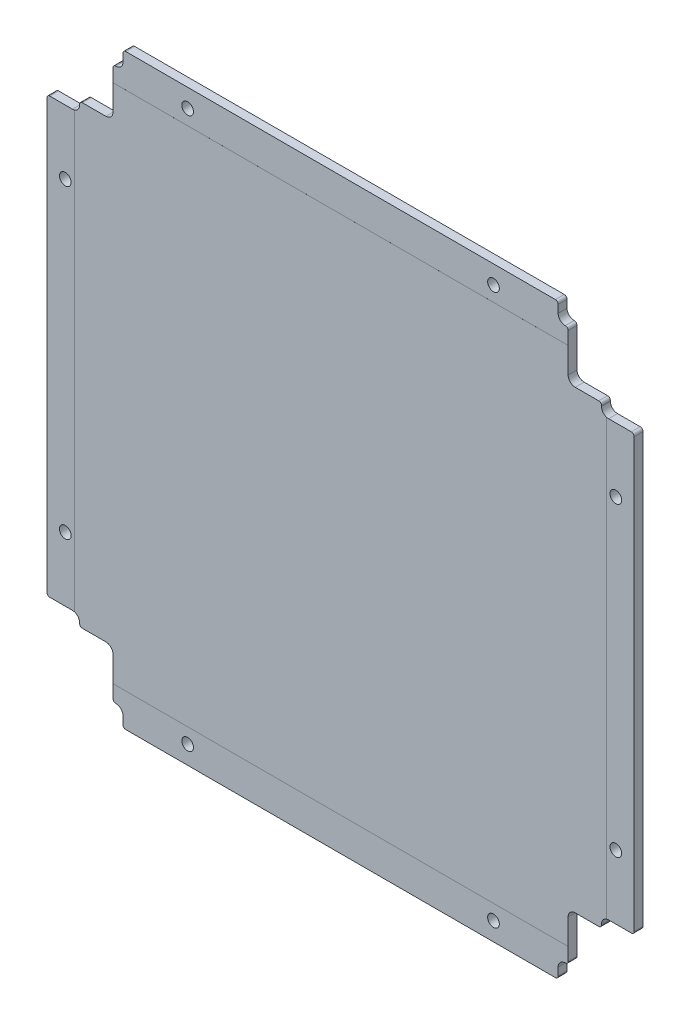
from build123d import *

# Parameters (mm, degrees)
SKETCH1_W                 = 106
SKETCH1_H                 = 106
MAINOUTLINE_DEPTH         = 1.6
SKETCH4_W                 = 11.7
SKETCH4_H                 = 11.7
RAILCUTOUTS_DEPTH         = 75.970394157
SKETCH13_W                = 5.7
SKETCH13_H                = 1.9
SKETCH13_W_2              = 1.8
SKETCH13_H_2              = 3
FILLETCUTOUTS_DEPTH       = 75.970394157
SMOOTHCORNER_DEPTH        = 10
MIRROR2_COPY_1_SKETCH_W   = 11.7
MIRROR2_COPY_1_SKETCH_H   = 11.7
MIRROR2_COPY_1_DEPTH      = 75.970394157
MIRROR2_COPY_2_SKETCH_W   = 5.7
MIRROR2_COPY_2_SKETCH_H   = 1.9
MIRROR2_COPY_2_SKETCH_W_2 = 1.8
MIRROR2_COPY_2_SKETCH_H_2 = 3
MIRROR2_COPY_2_DEPTH      = 75.970394157
MIRROR2_COPY_3_DEPTH      = 10
MIRROR2_COPY_4_SKETCH_W   = 11.7
MIRROR2_COPY_4_SKETCH_H   = 11.7
MIRROR2_COPY_4_DEPTH      = 75.970394157
MIRROR2_COPY_5_SKETCH_W   = 5.7
MIRROR2_COPY_5_SKETCH_H   = 1.9
MIRROR2_COPY_5_SKETCH_W_2 = 1.8
MIRROR2_COPY_5_SKETCH_H_2 = 3
MIRROR2_COPY_5_DEPTH      = 75.970394157
MIRROR2_COPY_6_DEPTH      = 10
FILLET10_R                = 0.5
M2_CLEARANCE_HOLE1_D      = 2.1
SKETCH15_W                = 90
SKETCH15_H                = 6.2
SKETCH15_W_2              = 5.2
SKETCH15_H_2              = 90
CUT_EXTRUDE5_DEPTH        = 0.001
SKETCH16_W                = 90
SKETCH16_H                = 6.2
SKETCH16_W_2              = 5.2
SKETCH16_H_2              = 90
CUT_EXTRUDE6_DEPTH        = 0.001
SKETCH24_OUTSIDE_W        = 137.984
SKETCH24_OUTSIDE_H        = 137.984
SKETCH24_OUTSIDE_W_2      = 105.6
SKETCH24_OUTSIDE_H_2      = 105.6
CUT_EXTRUDE19_DEPTH       = 75.970394157
FILLET7_R                 = 0.5


with BuildPart() as part:
    # Sketch1 → mainOutline (new body)
    with BuildSketch(Plane.XY):
        Rectangle(SKETCH1_W, SKETCH1_H)
    extrude(amount=MAINOUTLINE_DEPTH)

    # Sketch4 → railCutouts (cut, through all)
    with BuildSketch(Plane(origin=(0, 0, 0), x_dir=(-1, 0, 0), z_dir=(0, 0, -1))):
        with Locations((47.15, 47.15)):
            Rectangle(SKETCH4_W, SKETCH4_H)
    railcutouts = extrude(amount=-RAILCUTOUTS_DEPTH, mode=Mode.SUBTRACT)

    # Sketch13 → filletCutouts (cut, symmetric)
    with BuildSketch(Plane(origin=(0, 0, 0), x_dir=(-1, 0, 0), z_dir=(0, 0, -1))):
        with Locations((50.15, 40.35)):
            Rectangle(SKETCH13_W, SKETCH13_H)
        with Locations((40.4, 51.5)):
            Rectangle(SKETCH13_W_2, SKETCH13_H_2)
    filletcutouts = extrude(amount=FILLETCUTOUTS_DEPTH, both=True, mode=Mode.SUBTRACT)

    # Sketch27 → smoothCorner (cut)
    with BuildSketch(Plane.XY.offset(1.6)):
        with BuildLine():
            Line((-40.928025612, 42.198025612), (-40.928025612, 49.628025612))
            Line((-40.928025612, 49.628025612), (-40.398025612, 49.628025612))
            ThreePointArc((-40.398025612, 49.628025612), (-39.5, 50), (-39.128025612, 50.898025612))
            Line((-39.128025612, 50.898025612), (-39.128025612, 53))
            Line((-39.128025612, 53), (-53, 53))
            Line((-53, 53), (-53, 39.028025612))
            Line((-53, 39.028025612), (-48.198025612, 39.028025612))
            ThreePointArc((-48.198025612, 39.028025612), (-47.3, 39.4), (-46.928025612, 40.298025612))
            Line((-46.928025612, 40.298025612), (-46.928025612, 40.928025612))
            Line((-46.928025612, 40.928025612), (-42.198025612, 40.928025612))
            ThreePointArc((-42.198025612, 40.928025612), (-41.3, 41.3), (-40.928025612, 42.198025612))
        make_face()
    smoothcorner = extrude(amount=-SMOOTHCORNER_DEPTH, mode=Mode.SUBTRACT)

    # Mirror1: railCutouts, filletCutouts, smoothCorner across plane
    add(railcutouts.mirror(Plane(origin=(0, 0, 0), x_dir=(0, 0, 1), z_dir=(1, 0, 0))), mode=Mode.SUBTRACT)
    add(filletcutouts.mirror(Plane(origin=(0, 0, 0), x_dir=(0, 0, 1), z_dir=(1, 0, 0))), mode=Mode.SUBTRACT)
    add(smoothcorner.mirror(Plane(origin=(0, 0, 0), x_dir=(0, 0, 1), z_dir=(1, 0, 0))), mode=Mode.SUBTRACT)

    # Mirror2 copy 1 sketch → Mirror2 copy 1 (cut, through all)
    with BuildSketch(Plane(origin=(0, 0, 0), x_dir=(1, 0, 0), z_dir=(0, 0, -1))):
        with Locations((47.15, 47.15)):
            Rectangle(MIRROR2_COPY_1_SKETCH_W, MIRROR2_COPY_1_SKETCH_H)
    extrude(amount=-MIRROR2_COPY_1_DEPTH, mode=Mode.SUBTRACT)

    # Mirror2 copy 2 sketch → Mirror2 copy 2 (cut, symmetric)
    with BuildSketch(Plane(origin=(0, 0, 0), x_dir=(1, 0, 0), z_dir=(0, 0, -1))):
        with Locations((50.15, 40.35)):
            Rectangle(MIRROR2_COPY_2_SKETCH_W, MIRROR2_COPY_2_SKETCH_H)
        with Locations((40.4, 51.5)):
            Rectangle(MIRROR2_COPY_2_SKETCH_W_2, MIRROR2_COPY_2_SKETCH_H_2)
    extrude(amount=MIRROR2_COPY_2_DEPTH, both=True, mode=Mode.SUBTRACT)

    # Mirror2 copy 3 sketch → Mirror2 copy 3 (cut)
    with BuildSketch(Plane(origin=(0, 0, 1.6), x_dir=(-1, 0, 0), z_dir=(0, 0, 1))):
        with BuildLine():
            Line((-40.928025612, 42.198025612), (-40.928025612, 49.628025612))
            Line((-40.928025612, 49.628025612), (-40.398025612, 49.628025612))
            ThreePointArc((-40.398025612, 49.628025612), (-39.5, 50), (-39.128025612, 50.898025612))
            Line((-39.128025612, 50.898025612), (-39.128025612, 53))
            Line((-39.128025612, 53), (-53, 53))
            Line((-53, 53), (-53, 39.028025612))
            Line((-53, 39.028025612), (-48.198025612, 39.028025612))
            ThreePointArc((-48.198025612, 39.028025612), (-47.3, 39.4), (-46.928025612, 40.298025612))
            Line((-46.928025612, 40.298025612), (-46.928025612, 40.928025612))
            Line((-46.928025612, 40.928025612), (-42.198025612, 40.928025612))
            ThreePointArc((-42.198025612, 40.928025612), (-41.3, 41.3), (-40.928025612, 42.198025612))
        make_face()
    extrude(amount=-MIRROR2_COPY_3_DEPTH, mode=Mode.SUBTRACT)

    # Mirror2 copy 4 sketch → Mirror2 copy 4 (cut, through all)
    with BuildSketch(Plane(origin=(0, 0, 0), x_dir=(-1, 0, 0), z_dir=(0, 0, -1))):
        with Locations((47.15, -47.15)):
            Rectangle(MIRROR2_COPY_4_SKETCH_W, MIRROR2_COPY_4_SKETCH_H)
    extrude(amount=-MIRROR2_COPY_4_DEPTH, mode=Mode.SUBTRACT)

    # Mirror2 copy 5 sketch → Mirror2 copy 5 (cut, symmetric)
    with BuildSketch(Plane(origin=(0, 0, 0), x_dir=(-1, 0, 0), z_dir=(0, 0, -1))):
        with Locations((50.15, -40.35)):
            Rectangle(MIRROR2_COPY_5_SKETCH_W, MIRROR2_COPY_5_SKETCH_H)
        with Locations((40.4, -51.5)):
            Rectangle(MIRROR2_COPY_5_SKETCH_W_2, MIRROR2_COPY_5_SKETCH_H_2)
    extrude(amount=MIRROR2_COPY_5_DEPTH, both=True, mode=Mode.SUBTRACT)

    # Mirror2 copy 6 sketch → Mirror2 copy 6 (cut)
    with BuildSketch(Plane.XY.offset(1.6)):
        with BuildLine():
            Line((-40.928025612, -42.198025612), (-40.928025612, -49.628025612))
            Line((-40.928025612, -49.628025612), (-40.398025612, -49.628025612))
            ThreePointArc((-40.398025612, -49.628025612), (-39.5, -50), (-39.128025612, -50.898025612))
            Line((-39.128025612, -50.898025612), (-39.128025612, -53))
            Line((-39.128025612, -53), (-53, -53))
            Line((-53, -53), (-53, -39.028025612))
            Line((-53, -39.028025612), (-48.198025612, -39.028025612))
            ThreePointArc((-48.198025612, -39.028025612), (-47.3, -39.4), (-46.928025612, -40.298025612))
            Line((-46.928025612, -40.298025612), (-46.928025612, -40.928025612))
            Line((-46.928025612, -40.928025612), (-42.198025612, -40.928025612))
            ThreePointArc((-42.198025612, -40.928025612), (-41.3, -41.3), (-40.928025612, -42.198025612))
        make_face()
    extrude(amount=-MIRROR2_COPY_6_DEPTH, mode=Mode.SUBTRACT)

    # Fillet10
    fillet10_edges = [part.edges().sort_by_distance(p)[0] for p in [
        (46.928025612, -40.928025612, 0.8),
        (40.928025612, -49.628025612, 0.8),
        (40.928025612, 49.628025612, 0.8),
        (46.928025612, 40.928025612, 0.8),
        (-46.928025612, 40.928025612, 0.8),
        (-40.928025612, 49.628025612, 0.8),
        (-46.928025612, -40.928025612, 0.8),
        (-40.928025612, -49.628025612, 0.8),
    ]]
    fillet(fillet10_edges, radius=FILLET10_R)

    # M2 Clearance Hole1 (through all)
    with Locations(Plane(origin=(0, 0, 0), x_dir=(-1, 0, 0), z_dir=(0, 0, -1))):
        with Locations((49.5, -27.5), (27.5, -49.5), (-49.5, -27.5), (-27.5, -49.5), (-27.5, 49.5), (-49.5, 27.5), (27.5, 49.5), (49.5, 27.5)):
            Hole(M2_CLEARANCE_HOLE1_D / 2)

    # Sketch15 → Cut-Extrude5 (cut)
    with BuildSketch(Plane(origin=(0, 0, 0), x_dir=(-1, 0, 0), z_dir=(0, 0, -1))):
        with Locations((0, 49.9)):
            Rectangle(SKETCH15_W, SKETCH15_H)
        with Locations((0, -49.9)):
            Rectangle(SKETCH15_W, SKETCH15_H)
        with Locations((-50.4, 0)):
            Rectangle(SKETCH15_W_2, SKETCH15_H_2)
        with Locations((50.4, 0)):
            Rectangle(SKETCH15_W_2, SKETCH15_H_2)
    extrude(amount=-CUT_EXTRUDE5_DEPTH, mode=Mode.SUBTRACT)

    # Sketch16 → Cut-Extrude6 (cut)
    with BuildSketch(Plane.XY.offset(1.6)):
        with Locations((0, -49.9)):
            Rectangle(SKETCH16_W, SKETCH16_H)
        with Locations((0, 49.9)):
            Rectangle(SKETCH16_W, SKETCH16_H)
        with Locations((-50.4, 0)):
            Rectangle(SKETCH16_W_2, SKETCH16_H_2)
        with Locations((50.4, 0)):
            Rectangle(SKETCH16_W_2, SKETCH16_H_2)
    extrude(amount=-CUT_EXTRUDE6_DEPTH, mode=Mode.SUBTRACT)

    # Sketch24 outside → Cut-Extrude19 (cut, through all)
    with BuildSketch(Plane.XY.offset(1.6)):
        Rectangle(SKETCH24_OUTSIDE_W, SKETCH24_OUTSIDE_H)
        Rectangle(SKETCH24_OUTSIDE_W_2, SKETCH24_OUTSIDE_H_2, mode=Mode.SUBTRACT)
    extrude(amount=-CUT_EXTRUDE19_DEPTH, mode=Mode.SUBTRACT)

    # Fillet7
    fillet7_edges = [part.edges().sort_by_distance(p)[0] for p in [
        (-52.8, -39.028025612, 0.8),
        (-39.128025612, -52.8, 0.8),
        (39.128025612, -52.8, 0.8),
        (52.8, -39.028025612, 0.8),
        (52.8, 39.028025612, 0.8),
        (39.128025612, 52.8, 0.8),
        (-39.128025612, 52.8, 0.8),
        (-52.8, 39.028025612, 0.8),
    ]]
    fillet(fillet7_edges, radius=FILLET7_R)


solid = part.part
